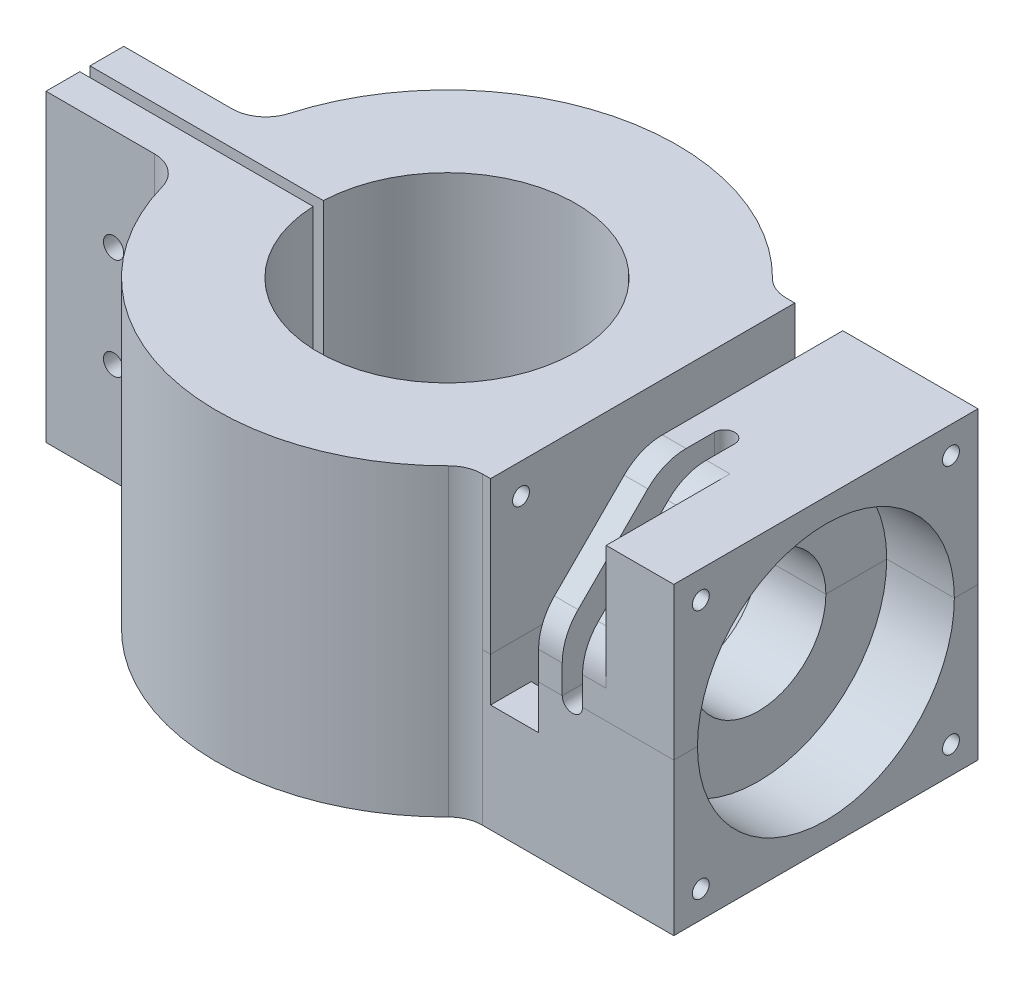
from build123d import *

# Parameters (mm, degrees)
BOSS_EXTRUDE1_DEPTH       = 22.5
F_3_0MM_DOWEL_HOLE1_D     = 3
BOSS_EXTRUDE2_START       = -8.493151603
BOSS_EXTRUDE2_OUTLINE_W   = 45
BOSS_EXTRUDE2_OUTLINE_H   = 45
BOSS_EXTRUDE2_DEPTH       = 30.493151603
SKETCH5_R                 = 10
CUT_EXTRUDE1_DEPTH        = 35
SKETCH16_R                = 19
CUT_EXTRUDE9_DEPTH        = 10
CUT_EXTRUDE2_START        = 22.5
SKETCH7_W                 = 7.1
SKETCH7_H                 = 45
CUT_EXTRUDE2_DEPTH        = 40
SKETCH8_W                 = 22.5
SKETCH8_H                 = 22.5
CUT_EXTRUDE3_DEPTH        = 1.5
CUT_EXTRUDE5_OUTLINE_W    = 1.5
CUT_EXTRUDE5_OUTLINE_H    = 12.613186919
CUT_EXTRUDE8_START        = 9
CUT_EXTRUDE8_DEPTH        = 14
CHAMFER1_START            = 36.05
CHAMFER1_DEPTH            = 10
FILLET3_R                 = 5
FILLET4_R                 = 8
BOSS_EXTRUDE3_DEPTH       = 7.1
M3X0_5_TAPPED_HOLE1_D     = 2.5
M3X0_5_TAPPED_HOLE1_DEPTH = 15
M3X0_5_TAPPED_HOLE1_TIP   = 0.751075774
SPLIT1_START              = 36.05
SPLIT1_2_DEPTH            = 10
SPLIT1_START_2            = 46.05
SPLIT1_3_OUTLINE_R        = 1.25
SPLIT1_3_DEPTH            = 10
SPLIT1_4_OUTLINE_R        = 1.25
SPLIT1_4_DEPTH            = 1.348924226
SPLIT1_START_3            = 47.398924226
SPLIT1_5_OUTLINE_R        = 1.25
SPLIT1_5_DEPTH            = 0.751075674
SPLIT1_6_DEPTH            = 22.5
SPLIT1_8_DEPTH            = 22.5


with BuildPart() as part:
    # Sketch3 → Boss-Extrude1 (new, symmetric)
    with BuildSketch(Plane(origin=(0, 0, 0), x_dir=(1, 0, 0), z_dir=(0, 1, 0))):
        with BuildLine():
            Line((-53.560989258, 0.75), (-53.560989258, 5.75))
            Line((-53.560989258, 5.75), (-33.560989258, 5.75))
            ThreePointArc((-33.560989258, 5.75), (34.05, 0), (-33.560989258, -5.75))
            Line((-33.560989258, -5.75), (-53.560989258, -5.75))
            Line((-53.560989258, -5.75), (-53.560989258, -0.75))
            Line((-53.560989258, -0.75), (-19.035230495, -0.75))
            ThreePointArc((-19.035230495, -0.75), (19.05, 0), (-19.035230495, 0.75))
            Line((-19.035230495, 0.75), (-53.560989258, 0.75))
        make_face()
    extrude(amount=BOSS_EXTRUDE1_DEPTH, both=True)

    # Ø3.0mm Dowel Hole1 (through all)
    with Locations(Plane.XY.offset(5.75)):
        with Locations((-43.560989258, 7.5), (-43.560989258, -7.5)):
            Hole(F_3_0MM_DOWEL_HOLE1_D / 2)

    # Boss-Extrude2: read off the stored shape, not the designer's step
    # Boss-Extrude2 outline → Boss-Extrude2 (add)
    with BuildSketch(Plane(origin=(34.05, 0, 0), x_dir=(0, 0, -1), z_dir=(1, 0, 0)).offset(BOSS_EXTRUDE2_START)):
        Rectangle(BOSS_EXTRUDE2_OUTLINE_W, BOSS_EXTRUDE2_OUTLINE_H)
    extrude(amount=BOSS_EXTRUDE2_DEPTH)

    # Sketch5 → Cut-Extrude1 (cut)
    with BuildSketch(Plane(origin=(56.05, 0, 0), x_dir=(0, 0, -1), z_dir=(1, 0, 0))):
        Circle(SKETCH5_R)
    extrude(amount=-CUT_EXTRUDE1_DEPTH, mode=Mode.SUBTRACT)

    # Sketch16 → Cut-Extrude9 (cut)
    with BuildSketch(Plane(origin=(56.05, 0, 0), x_dir=(0, 0, -1), z_dir=(1, 0, 0))):
        Circle(SKETCH16_R)
    extrude(amount=-CUT_EXTRUDE9_DEPTH, mode=Mode.SUBTRACT)

    # Sketch7 → Cut-Extrude2 (cut)
    with BuildSketch(Plane(origin=(0, 0, 0), x_dir=(1, 0, 0), z_dir=(0, 1, 0)).offset(CUT_EXTRUDE2_START)):
        with Locations((32.5, 0)):
            Rectangle(SKETCH7_W, SKETCH7_H)
    extrude(amount=-CUT_EXTRUDE2_DEPTH, mode=Mode.SUBTRACT)

    # Sketch8 → Cut-Extrude3 (cut, symmetric)
    with BuildSketch(Plane.ZY.offset(-41.05)):
        with Locations((11.25, 11.25)):
            Rectangle(SKETCH8_W, SKETCH8_H)
    extrude(amount=CUT_EXTRUDE3_DEPTH, both=True, mode=Mode.SUBTRACT)

    # Cut-Extrude5: read off the stored shape, not the designer's step
    # Cut-Extrude5 outline → Cut-Extrude5 (revolve, cut)
    with BuildSketch(Plane(origin=(41.05, 0, 0), x_dir=(1, 0, 0), z_dir=(0, -1, 0))):
        with Locations((0.75, 16.19340654)):
            Rectangle(CUT_EXTRUDE5_OUTLINE_W, CUT_EXTRUDE5_OUTLINE_H)
    revolve(axis=Axis((41.05, 0, 0), (0, 0, 1)), mode=Mode.SUBTRACT)

    # Cut-Extrude8: read off the stored shape, not the designer's step
    # Cut-Extrude8 outline → Cut-Extrude8 (cut)
    with BuildSketch(Plane(origin=(0, 0, 0), x_dir=(1, 0, 0), z_dir=(0, 1, 0)).offset(CUT_EXTRUDE8_START)):
        with BuildLine():
            ThreePointArc((42.55, 0), (41.05, 1.5), (39.55, 0))
            Line((39.55, 0), (42.55, 0))
        make_face()
    extrude(amount=CUT_EXTRUDE8_DEPTH, mode=Mode.SUBTRACT)

    # Chamfer1: read off the stored shape, not the designer's step
    # Chamfer1 outline → Chamfer1 (cut)
    with BuildSketch(Plane.YZ.offset(CHAMFER1_START)):
        Polygon((22.5, 22.5), (7.5, 22.5), (22.5, 7.5), align=None)
    extrude(amount=CHAMFER1_DEPTH, mode=Mode.SUBTRACT)

    # Fillet3
    fillet3_edges = [part.edges().sort_by_distance(p)[0] for p in [
        (-33.560989258, 0, -5.75),
        (-33.560989258, 0, 5.75),
        (25.556848397, 0, -22.5),
        (25.556848397, 0, 22.5),
    ]]
    fillet(fillet3_edges, radius=FILLET3_R)

    # Fillet4
    fillet4_edges = [part.edges().sort_by_distance(p)[0] for p in [
        (37.8, 22.5, 7.5),
        (44.3, 22.5, 7.5),
        (37.8, 7.5, 22.5),
        (44.3, 7.5, 22.5),
    ]]
    fillet(fillet4_edges, radius=FILLET4_R)

    # Sketch15 → Boss-Extrude3 (add)
    with BuildSketch(Plane(origin=(28.95, 0, 0), x_dir=(0, 0, -1), z_dir=(1, 0, 0))):
        Polygon((-22.5, -6.5), (-16.5, -6.5), (-10.5, -17.5), (-22.5, -17.5), align=None)
        Polygon((22.5, -6.5), (16.5, -6.5), (10.5, -17.5), (22.5, -17.5), align=None)
    extrude(amount=BOSS_EXTRUDE3_DEPTH)

    # M3x0.5 Tapped Hole1
    with Locations(Plane(origin=(63.15, 0, 0), x_dir=(0, 0, -1), z_dir=(1, 0, 0))):
        with Locations((-18.5, 18.5), (-18.5, -18.5), (18.5, -18.5), (18.5, 18.5)):
            Hole(M3X0_5_TAPPED_HOLE1_D / 2, depth=M3X0_5_TAPPED_HOLE1_DEPTH)
            with Locations((0, 0, -(M3X0_5_TAPPED_HOLE1_DEPTH + M3X0_5_TAPPED_HOLE1_TIP / 2))):  # 118° drill point
                Cone(0, M3X0_5_TAPPED_HOLE1_D / 2, M3X0_5_TAPPED_HOLE1_TIP, mode=Mode.SUBTRACT)

    # Sketch20 → M3x0.5 Tapped Hole2 (revolve, cut)
    with BuildSketch(Plane(origin=(36, 18, 18), x_dir=(0, 0, -1), z_dir=(0, 1, 0))):
        Polygon((0, 0), (0, 15.751075774), (1.25, 15), (1.25, 0), align=None)
    revolve(axis=Axis((42.35, 18, 18), (-1, 0, 0)), mode=Mode.SUBTRACT)

    # Split1 8 outline → Split1 8 (cut)
    with BuildSketch(Plane(origin=(0, 0, 0), x_dir=(1, 0, 0), z_dir=(0, 1, 0))):
        with BuildLine():
            Line((36.05, 22.5), (36.05, -22.5))
            Line((36.05, -22.5), (39.55, -22.5))
            Line((39.55, -22.5), (39.55, 0))
            ThreePointArc((39.55, 0), (41.05, 1.5), (42.55, 0))
            Line((42.55, 0), (42.55, -22.5))
            Line((42.55, -22.5), (56.05, -22.5))
            Line((56.05, -22.5), (56.05, 22.5))
            Line((56.05, 22.5), (36.05, 22.5))
        make_face()
    extrude(amount=SPLIT1_8_DEPTH, mode=Mode.SUBTRACT)


with BuildPart() as body_2:
    # Split1: read off the stored shape, not the designer's step
    # Split1 outline → Split1 (revolve)
    with BuildSketch(Plane(origin=(0, 18.5, -18.5), x_dir=(0, 1, 0), z_dir=(0, 0, -1))):
        Polygon((1.25, 48.15), (0, 47.398924226), (1.25, 47.398924226), align=None)
    revolve(axis=Axis((0, 18.5, -18.5), (1, 0, 0)))

    # Split1 2 outline → Split1 2 (add)
    with BuildSketch(Plane.YZ.offset(SPLIT1_START)):
        with BuildLine():
            ThreePointArc((0, 10), (10, 0), (0, -10))
            Line((0, -10), (0, -22.5))
            Line((0, -22.5), (22.5, -22.5))
            Line((22.5, -22.5), (22.5, 4.186291501))
            ThreePointArc((22.5, 4.186291501), (21.89103626, 7.24775896), (20.156854249, 9.843145751))
            Line((20.156854249, 9.843145751), (9.843145751, 20.156854249))
            ThreePointArc((9.843145751, 20.156854249), (7.24775896, 21.89103626), (4.186291501, 22.5))
            Line((4.186291501, 22.5), (0, 22.5))
            Line((0, 22.5), (0, 10))
        make_face()
    extrude(amount=SPLIT1_2_DEPTH)

    # Split1 3 outline → Split1 3 (add)
    with BuildSketch(Plane.YZ.offset(SPLIT1_START_2)):
        with BuildLine():
            ThreePointArc((0, 19), (19, 0), (0, -19))
            Line((0, -19), (0, -22.5))
            Line((0, -22.5), (22.5, -22.5))
            Line((22.5, -22.5), (22.5, 22.5))
            Line((22.5, 22.5), (0, 22.5))
            Line((0, 22.5), (0, 19))
        make_face()
        with Locations((18.5, -18.5)):
            Circle(SPLIT1_3_OUTLINE_R, mode=Mode.SUBTRACT)
        with Locations((18.5, 18.5)):
            Circle(SPLIT1_3_OUTLINE_R, mode=Mode.SUBTRACT)
    extrude(amount=SPLIT1_3_DEPTH)

    # Split1 4 outline → Split1 4 (add)
    with BuildSketch(Plane.YZ.offset(SPLIT1_START_2)):
        with Locations((18.5, 18.5)):
            Circle(SPLIT1_4_OUTLINE_R)
        with Locations((18.5, -18.5)):
            Circle(SPLIT1_4_OUTLINE_R)
    extrude(amount=SPLIT1_4_DEPTH)

    # Split1 5 outline → Split1 5 (add)
    with BuildSketch(Plane.YZ.offset(SPLIT1_START_3)):
        with Locations((18.5, 18.5)):
            Circle(SPLIT1_5_OUTLINE_R)
    extrude(amount=SPLIT1_5_DEPTH)

    # Split1 6 outline → Split1 6 (cut)
    with BuildSketch(Plane(origin=(0, 0, 0), x_dir=(1, 0, 0), z_dir=(0, 1, 0))):
        with BuildLine():
            ThreePointArc((42.55, 0), (41.05, 1.5), (39.55, 0))
            Line((39.55, 0), (39.55, -22.5))
            Line((39.55, -22.5), (42.55, -22.5))
            Line((42.55, -22.5), (42.55, 0))
        make_face()
    extrude(amount=SPLIT1_6_DEPTH, mode=Mode.SUBTRACT)

    # Split1 7 outline → Split1 7 (revolve, cut)
    with BuildSketch(Plane(origin=(0, 18.5, 18.5), x_dir=(0, 1, 0), z_dir=(0, 0, -1))):
        Polygon((0, 48.15), (0, 47.398924226), (1.25, 48.15), align=None)
    revolve(axis=Axis((0, 18.5, 18.5), (1, 0, 0)), mode=Mode.SUBTRACT)


solid = Compound([part.part, body_2.part])
